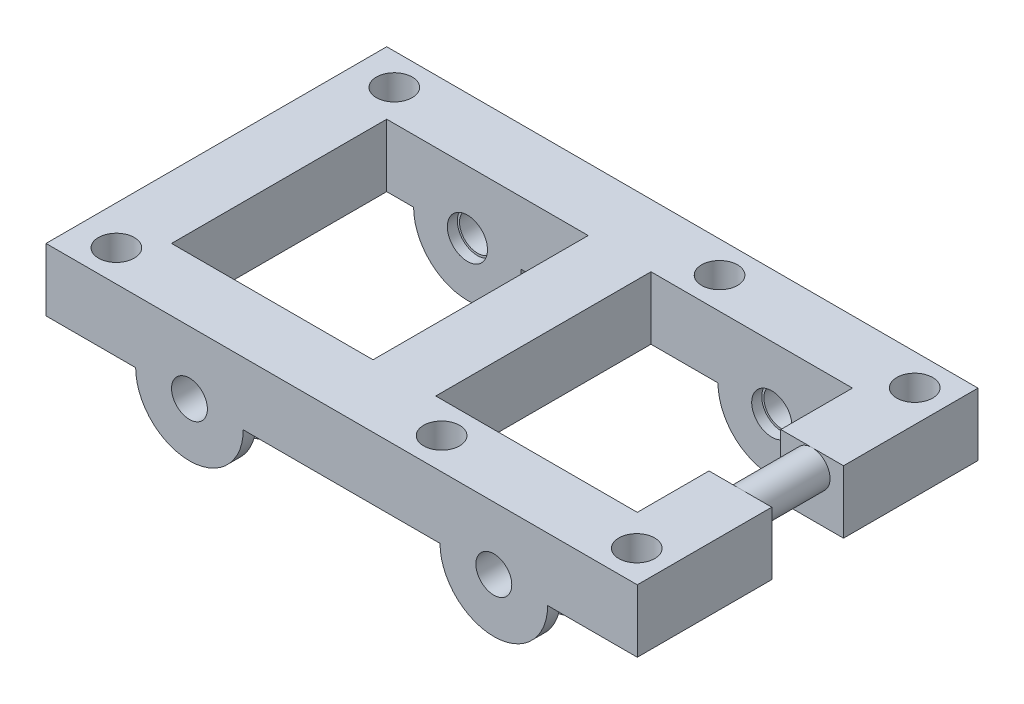
from build123d import *

# Parameters (mm, degrees)
SKETCH1_W                    = 104.687624
SKETCH1_H                    = 60.325
SKETCH1_W_2                  = 35.675062
SKETCH1_H_2                  = 38.1
BOSS_EXTRUDE1_DEPTH          = 11.1125
BOSS_EXTRUDE32_DEPTH         = 11.1125
BOSS_EXTRUDE36_START         = -49.2125
BOSS_EXTRUDE36_DEPTH         = 11.1125
CUT_EXTRUDE1_REACH           = 124.575
SKETCH9_W                    = 11.1125
SKETCH9_H                    = 12.7
BOSS_EXTRUDE37_REACH         = 113.428
SKETCH10_R                   = 3.175
F_97_0_0059_DIAMETER_HOLE1_D = 6.35
SKETCH17_R                   = 3.556
CUT_EXTRUDE2_DEPTH           = 1.778
CUT_EXTRUDE3_START           = -1.778
SKETCH18_R                   = 3.556
CUT_EXTRUDE3_DEPTH           = 1.778
SKETCH19_R                   = 3.175
CUT_EXTRUDE4_DEPTH           = 5.842
CUT_EXTRUDE7_DEPTH           = 122.72719936
CUT_EXTRUDE7_DEPTH_BACK      = 122.72719936
SKETCH20_R                   = 3.556
SHELL4_START                 = -9.525
SHELL4_DEPTH                 = 18.3515
SHELL4_START_2               = -38.7985
SHELL4_2_OUTLINE_R           = 0.889
SHELL4_2_DEPTH               = 17.272
SHELL4_START_3               = -58.039
SHELL4_3_OUTLINE_R           = 5.461
SHELL4_3_OUTLINE_R_2         = 3.175
SHELL4_3_DEPTH               = 6.5405
SHELL4_START_4               = -8.8265
SHELL4_4_OUTLINE_R           = 5.461
SHELL4_4_OUTLINE_R_2         = 3.175
SHELL4_4_DEPTH               = 6.5405
SHELL4_START_5               = -53.2765
SHELL4_5_OUTLINE_R           = 5.842
SHELL4_5_OUTLINE_R_2         = 5.461
SHELL4_5_DEPTH               = 1.778
SHELL4_6_OUTLINE_R           = 5.842
SHELL4_6_OUTLINE_R_2         = 5.461
SHELL4_6_DEPTH               = 1.778
SKETCH21_W                   = 10.922
SKETCH21_H                   = 6.5405
BOSS_EXTRUDE39_DEPTH         = 8.382
SKETCH22_R                   = 3.175
CUT_EXTRUDE6_DEPTH           = 122.334627786
SKETCH23_W                   = 1.27
SKETCH23_H                   = 6.5405
CUT_EXTRUDE8_DEPTH           = 122.334627786
SKETCH24_R                   = 3.556
SKETCH24_R_2                 = 3.175
BOSS_EXTRUDE40_DEPTH         = 5.842


with BuildPart() as part:
    # Sketch1 → Boss-Extrude1 (new body)
    with BuildSketch(Plane(origin=(0, 0, 0), x_dir=(1, 0, 0), z_dir=(0, 1, 0))):
        with Locations((52.343812, 30.1625)):
            Rectangle(SKETCH1_W, SKETCH1_H)
        with Locations((28.950031, 30.1625)):
            Rectangle(SKETCH1_W_2, SKETCH1_H_2, mode=Mode.SUBTRACT)
        with Locations((75.737593, 30.1625)):
            Rectangle(SKETCH1_W_2, SKETCH1_H_2, mode=Mode.SUBTRACT)
    extrude(amount=BOSS_EXTRUDE1_DEPTH)

    # Sketch2 → Boss-Extrude32 (add)
    with BuildSketch(Plane.XY):
        with BuildLine():
            Line((0, 11.1125), (0, 0))
            Line((0, 0), (15.875, 0))
            ThreePointArc((15.875, 0), (25.4, -9.525), (34.925, 0))
            Line((34.925, 0), (69.762624, 0))
            ThreePointArc((69.762624, 0), (79.287624, -9.525), (88.812624, 0))
            Line((88.812624, 0), (104.687624, 0))
            Line((104.687624, 0), (104.687624, 11.1125))
            Line((104.687624, 11.1125), (0, 11.1125))
        make_face()
    extrude(amount=-BOSS_EXTRUDE32_DEPTH)

    # Sketch2<11> → Boss-Extrude36 (add)
    with BuildSketch(Plane.XY.offset(BOSS_EXTRUDE36_START)):
        with BuildLine():
            Line((0, 11.1125), (0, 0))
            Line((0, 0), (15.875, 0))
            ThreePointArc((15.875, 0), (25.4, -9.525), (34.925, 0))
            Line((34.925, 0), (69.762624, 0))
            ThreePointArc((69.762624, 0), (79.287624, -9.525), (88.812624, 0))
            Line((88.812624, 0), (104.687624, 0))
            Line((104.687624, 0), (104.687624, 11.1125))
            Line((104.687624, 11.1125), (0, 11.1125))
        make_face()
    extrude(amount=-BOSS_EXTRUDE36_DEPTH)

    # Sketch9 → Cut-Extrude1 (cut, up to next)
    with BuildSketch(Plane(origin=(0, 11.1125, 0), x_dir=(1, 0, 0), z_dir=(0, 1, 0)), mode=Mode.PRIVATE) as cut_extrude1_sk1:
        with Locations((99.131374, 30.1625)):
            Rectangle(SKETCH9_W, SKETCH9_H)
    cut_extrude1_tool1 = extrude(cut_extrude1_sk1.sketch, amount=-CUT_EXTRUDE1_REACH, mode=Mode.PRIVATE) & part.part
    add(cut_extrude1_tool1.solids().sort_by_distance((99.131374, 11.1125, -30.1625))[0], mode=Mode.SUBTRACT)

    # Sketch10 → Boss-Extrude37 (add, up to next)
    with BuildSketch(Plane.XY.offset(-36.5125), mode=Mode.PRIVATE) as boss_extrude37_sk1:
        with Locations(Location((99.131374, 7.9375, 0), (0, 0, 90))):
            Circle(SKETCH10_R)
    boss_extrude37_tool1 = extrude(boss_extrude37_sk1.sketch, amount=BOSS_EXTRUDE37_REACH, mode=Mode.PRIVATE) - part.part
    add(boss_extrude37_tool1.solids().sort_by_distance((99.131374, 7.9375, -36.5125))[0])

    # #97 (0.0059) Diameter Hole1 (through all)
    with Locations(Plane.XY):
        with Locations((25.4, 0), (79.287624, 0)):
            Hole(F_97_0_0059_DIAMETER_HOLE1_D / 2)

    # Sketch17 → Cut-Extrude2 (cut)
    with BuildSketch(Plane(origin=(0, 0, -11.1125), x_dir=(-1, 0, 0), z_dir=(0, 0, -1))):
        with Locations((-25.4, 0)):
            Circle(SKETCH17_R)
        with Locations((-79.287624, 0)):
            Circle(SKETCH17_R)
    extrude(amount=-CUT_EXTRUDE2_DEPTH, mode=Mode.SUBTRACT)

    # Sketch18 → Cut-Extrude3 (cut)
    with BuildSketch(Plane.XY.offset(-49.2125).offset(CUT_EXTRUDE3_START)):
        with Locations(Location((25.4, 0, 0), (0, 0, 180))):
            Circle(SKETCH18_R)
        with Locations(Location((79.287624, 0, 0), (0, 0, 180))):
            Circle(SKETCH18_R)
    extrude(amount=CUT_EXTRUDE3_DEPTH, mode=Mode.SUBTRACT)

    # Sketch19 → Cut-Extrude4 (cut)
    with BuildSketch(Plane(origin=(0, 11.1125, 0), x_dir=(1, 0, 0), z_dir=(0, 1, 0))):
        with Locations(Location((99.036124, 54.76875, 0), (0, 0, 270))):
            Circle(SKETCH19_R)
        with Locations(Location((64.487044, 54.76875, 0), (0, 0, 270))):
            Circle(SKETCH19_R)
        with Locations((-40.811196, 54.76875)):
            Circle(SKETCH19_R)
        with Locations(Location((99.036124, 5.55625, 0), (0, 0, 270))):
            Circle(SKETCH19_R)
        with Locations(Location((64.487044, 5.55625, 0), (0, 0, 270))):
            Circle(SKETCH19_R)
        with Locations((-40.811196, 5.55625)):
            Circle(SKETCH19_R)
    extrude(amount=-CUT_EXTRUDE4_DEPTH, mode=Mode.SUBTRACT)

    # Sketch20 → Cut-Extrude7 (cut, two sides: drawn at the far end of the back side and taken through both)
    with BuildSketch(Plane(origin=(0, 5.2705, 0), x_dir=(1, 0, 0), z_dir=(0, 1, 0)).offset(-CUT_EXTRUDE7_DEPTH_BACK)):
        with Locations(Location((99.036124, 54.76875, 0), (0, 0, 270))):
            Circle(SKETCH20_R)
        with Locations(Location((64.487044, 54.76875, 0), (0, 0, 270))):
            Circle(SKETCH20_R)
        with Locations(Location((6.90118, 54.76875, 0), (0, 0, 270))):
            Circle(SKETCH20_R)
        with Locations(Location((6.90118, 5.55625, 0), (0, 0, 270))):
            Circle(SKETCH20_R)
        with Locations(Location((64.487044, 5.55625, 0), (0, 0, 270))):
            Circle(SKETCH20_R)
        with Locations(Location((99.036124, 5.55625, 0), (0, 0, 270))):
            Circle(SKETCH20_R)
    extrude(amount=CUT_EXTRUDE7_DEPTH + CUT_EXTRUDE7_DEPTH_BACK, mode=Mode.SUBTRACT)

    # Shell4: read off the stored shape, not the designer's step
    # Shell4 outline → Shell4 (cut)
    with BuildSketch(Plane(origin=(0, 0, 0), x_dir=(1, 0, 0), z_dir=(0, 1, 0)).offset(SHELL4_START)):
        with BuildLine():
            ThreePointArc((94.195212006, 51.4985), (93.194124, 54.76875), (94.195212006, 58.039))
            Line((94.195212006, 58.039), (69.327955994, 58.039))
            ThreePointArc((69.327955994, 58.039), (70.329044, 54.76875), (69.327955994, 51.4985))
            Line((69.327955994, 51.4985), (94.195212006, 51.4985))
        make_face()
        with BuildLine():
            ThreePointArc((102.401624, 49.993566888), (99.151081614, 48.927881165), (95.861124, 49.864839418))
            Line((95.861124, 49.864839418), (95.861124, 38.7985))
            Line((95.861124, 38.7985), (102.401624, 38.7985))
            Line((102.401624, 38.7985), (102.401624, 49.993566888))
        make_face()
        with BuildLine():
            Line((59.646132006, 58.039), (11.742091994, 58.039))
            ThreePointArc((11.742091994, 58.039), (12.74318, 54.76875), (11.742091994, 51.4985))
            Line((11.742091994, 51.4985), (49.073562, 51.4985))
            Line((49.073562, 51.4985), (49.073562, 8.8265))
            Line((49.073562, 8.8265), (11.742091994, 8.8265))
            ThreePointArc((11.742091994, 8.8265), (12.74318, 5.55625), (11.742091994, 2.286))
            Line((11.742091994, 2.286), (59.646132006, 2.286))
            ThreePointArc((59.646132006, 2.286), (58.645044, 5.55625), (59.646132006, 8.8265))
            Line((59.646132006, 8.8265), (55.614062, 8.8265))
            Line((55.614062, 8.8265), (55.614062, 51.4985))
            Line((55.614062, 51.4985), (59.646132006, 51.4985))
            ThreePointArc((59.646132006, 51.4985), (58.645044, 54.76875), (59.646132006, 58.039))
        make_face()
        with BuildLine():
            ThreePointArc((94.195212006, 2.286), (93.194124, 5.55625), (94.195212006, 8.8265))
            Line((94.195212006, 8.8265), (69.327955994, 8.8265))
            ThreePointArc((69.327955994, 8.8265), (70.329044, 5.55625), (69.327955994, 2.286))
            Line((69.327955994, 2.286), (94.195212006, 2.286))
        make_face()
        with BuildLine():
            ThreePointArc((8.8265, 49.25312611), (5.244742783, 49.16650226), (2.286, 51.186979828))
            Line((2.286, 51.186979828), (2.286, 9.138020172))
            ThreePointArc((2.286, 9.138020172), (5.244742783, 11.15849774), (8.8265, 11.07187389))
            Line((8.8265, 11.07187389), (8.8265, 49.25312611))
        make_face()
        with BuildLine():
            ThreePointArc((95.861124, 10.460160582), (99.151081614, 11.397118835), (102.401624, 10.331433112))
            Line((102.401624, 10.331433112), (102.401624, 21.5265))
            Line((102.401624, 21.5265), (95.861124, 21.5265))
            Line((95.861124, 21.5265), (95.861124, 10.460160582))
        make_face()
    extrude(amount=SHELL4_DEPTH, mode=Mode.SUBTRACT)

    # Shell4 2 outline → Shell4 2 (cut)
    with BuildSketch(Plane.XY.offset(SHELL4_START_2)):
        with Locations((99.131374, 7.9375)):
            Circle(SHELL4_2_OUTLINE_R)
    extrude(amount=SHELL4_2_DEPTH, mode=Mode.SUBTRACT)

    # Shell4 3 outline → Shell4 3 (add)
    # profile 1 of 2: a face of its own
    with BuildSketch(Plane.XY.offset(SHELL4_START_3)):
        with Locations((79.287624, 0)):
            Circle(SHELL4_3_OUTLINE_R)
        with Locations((79.287624, 0)):
            Circle(SHELL4_3_OUTLINE_R_2, mode=Mode.SUBTRACT)
    # profile 2 of 2: a face of its own
    with BuildSketch(Plane.XY.offset(SHELL4_START_3)):
        with Locations((25.4, 0)):
            Circle(SHELL4_3_OUTLINE_R)
        with Locations((25.4, 0)):
            Circle(SHELL4_3_OUTLINE_R_2, mode=Mode.SUBTRACT)
    extrude(amount=SHELL4_3_DEPTH)

    # Shell4 4 outline → Shell4 4 (add)
    # profile 1 of 2: a face of its own
    with BuildSketch(Plane.XY.offset(SHELL4_START_4)):
        with Locations((79.287624, 0)):
            Circle(SHELL4_4_OUTLINE_R)
        with Locations((79.287624, 0)):
            Circle(SHELL4_4_OUTLINE_R_2, mode=Mode.SUBTRACT)
    # profile 2 of 2: a face of its own
    with BuildSketch(Plane.XY.offset(SHELL4_START_4)):
        with Locations((25.4, 0)):
            Circle(SHELL4_4_OUTLINE_R)
        with Locations((25.4, 0)):
            Circle(SHELL4_4_OUTLINE_R_2, mode=Mode.SUBTRACT)
    extrude(amount=SHELL4_4_DEPTH)

    # Shell4 5 outline → Shell4 5 (add)
    # profile 1 of 2: a face of its own
    with BuildSketch(Plane.XY.offset(SHELL4_START_5)):
        with Locations((79.287624, 0)):
            Circle(SHELL4_5_OUTLINE_R)
        with Locations((79.287624, 0)):
            Circle(SHELL4_5_OUTLINE_R_2, mode=Mode.SUBTRACT)
    # profile 2 of 2: a face of its own
    with BuildSketch(Plane.XY.offset(SHELL4_START_5)):
        with Locations((25.4, 0)):
            Circle(SHELL4_5_OUTLINE_R)
        with Locations((25.4, 0)):
            Circle(SHELL4_5_OUTLINE_R_2, mode=Mode.SUBTRACT)
    extrude(amount=SHELL4_5_DEPTH)

    # Shell4 6 outline → Shell4 6 (add)
    # profile 1 of 2: a face of its own
    with BuildSketch(Plane.XY.offset(SHELL4_START_4)):
        with Locations((79.287624, 0)):
            Circle(SHELL4_6_OUTLINE_R)
        with Locations((79.287624, 0)):
            Circle(SHELL4_6_OUTLINE_R_2, mode=Mode.SUBTRACT)
    # profile 2 of 2: a face of its own
    with BuildSketch(Plane.XY.offset(SHELL4_START_4)):
        with Locations((25.4, 0)):
            Circle(SHELL4_6_OUTLINE_R)
        with Locations((25.4, 0)):
            Circle(SHELL4_6_OUTLINE_R_2, mode=Mode.SUBTRACT)
    extrude(amount=SHELL4_6_DEPTH)

    # Sketch21 → Boss-Extrude39 (add)
    with BuildSketch(Plane.XZ.offset(-8.8265)):
        with Locations((79.287624, -5.55625)):
            Rectangle(SKETCH21_W, SKETCH21_H)
        with Locations((79.287624, -54.76875)):
            Rectangle(SKETCH21_W, SKETCH21_H)
        with Locations((25.4, -54.76875)):
            Rectangle(SKETCH21_W, SKETCH21_H)
        with Locations((25.4, -5.55625)):
            Rectangle(SKETCH21_W, SKETCH21_H)
    extrude(amount=BOSS_EXTRUDE39_DEPTH)

    # Sketch22 → Cut-Extrude6 (cut, through all)
    with BuildSketch(Plane.XY):
        with Locations((25.4, 0)):
            Circle(SKETCH22_R)
        with Locations((79.287624, 0)):
            Circle(SKETCH22_R)
    extrude(amount=-CUT_EXTRUDE6_DEPTH, mode=Mode.SUBTRACT)

    # Sketch23 → Cut-Extrude8 (cut, through all)
    with BuildSketch(Plane.XZ):
        with Locations((69.962955994, -5.55625)):
            Rectangle(SKETCH23_W, SKETCH23_H)
        with Locations((69.962955994, -54.76875)):
            Rectangle(SKETCH23_W, SKETCH23_H)
    extrude(amount=CUT_EXTRUDE8_DEPTH, mode=Mode.SUBTRACT)

    # Sketch24 → Boss-Extrude40 (add)
    # profile 1 of 6: a face of its own
    with BuildSketch(Plane(origin=(0, 11.1125, 0), x_dir=(1, 0, 0), z_dir=(0, 1, 0))):
        with Locations(Location((64.487044, 5.55625, 0), (0, 0, 270))):
            Circle(SKETCH24_R)
        with Locations(Location((64.487044, 5.55625, 0), (0, 0, 270))):
            Circle(SKETCH24_R_2, mode=Mode.SUBTRACT)
    # profile 2 of 6: a face of its own
    with BuildSketch(Plane(origin=(0, 11.1125, 0), x_dir=(1, 0, 0), z_dir=(0, 1, 0))):
        with Locations(Location((6.90118, 54.76875, 0), (0, 0, 270))):
            Circle(SKETCH24_R)
        with Locations(Location((6.90118, 54.76875, 0), (0, 0, 270))):
            Circle(SKETCH24_R_2, mode=Mode.SUBTRACT)
    # profile 3 of 6: a face of its own
    with BuildSketch(Plane(origin=(0, 11.1125, 0), x_dir=(1, 0, 0), z_dir=(0, 1, 0))):
        with Locations(Location((64.487044, 54.76875, 0), (0, 0, 270))):
            Circle(SKETCH24_R)
        with Locations(Location((64.487044, 54.76875, 0), (0, 0, 270))):
            Circle(SKETCH24_R_2, mode=Mode.SUBTRACT)
    # profile 4 of 6: a face of its own
    with BuildSketch(Plane(origin=(0, 11.1125, 0), x_dir=(1, 0, 0), z_dir=(0, 1, 0))):
        with Locations(Location((99.036124, 54.76875, 0), (0, 0, 270))):
            Circle(SKETCH24_R)
        with Locations(Location((99.036124, 54.76875, 0), (0, 0, 270))):
            Circle(SKETCH24_R_2, mode=Mode.SUBTRACT)
    # profile 5 of 6: a face of its own
    with BuildSketch(Plane(origin=(0, 11.1125, 0), x_dir=(1, 0, 0), z_dir=(0, 1, 0))):
        with Locations(Location((99.036124, 5.55625, 0), (0, 0, 270))):
            Circle(SKETCH24_R)
        with Locations(Location((99.036124, 5.55625, 0), (0, 0, 270))):
            Circle(SKETCH24_R_2, mode=Mode.SUBTRACT)
    # profile 6 of 6: a face of its own
    with BuildSketch(Plane(origin=(0, 11.1125, 0), x_dir=(1, 0, 0), z_dir=(0, 1, 0))):
        with Locations(Location((6.90118, 5.55625, 0), (0, 0, 270))):
            Circle(SKETCH24_R)
        with Locations(Location((6.90118, 5.55625, 0), (0, 0, 270))):
            Circle(SKETCH24_R_2, mode=Mode.SUBTRACT)
    extrude(amount=-BOSS_EXTRUDE40_DEPTH)


solid = part.part
